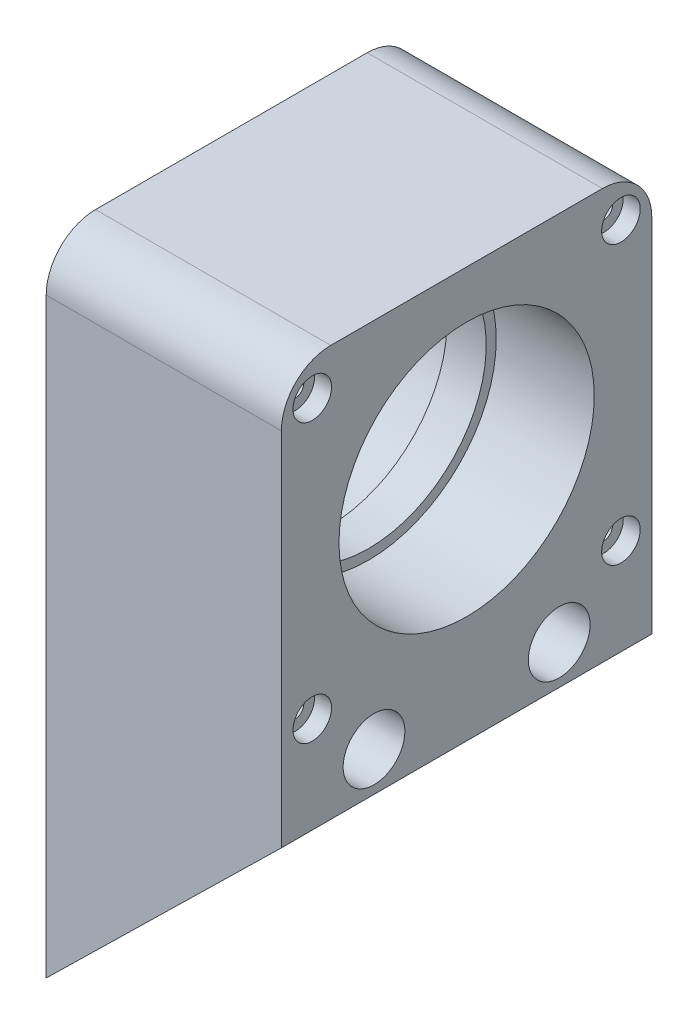
from build123d import *

# Parameters (mm, degrees)
BOSS_EXTRUDE1_DEPTH = 120
SKETCH3_R           = 4.25
CUT_EXTRUDE1_DEPTH  = 120
SKETCH5_R           = 10
CUT_EXTRUDE2_DEPTH  = 53
SKETCH6_R           = 4.25
CUT_EXTRUDE3_DEPTH  = 103
SKETCH7_W           = 76.2
SKETCH7_H           = 120
BOSS_EXTRUDE2_DEPTH = 101.6
SKETCH8_R           = 41.35
CUT_EXTRUDE4_DEPTH  = 31.75
CUT_EXTRUDE5_START  = -31.75
SKETCH9_R           = 41.35
CUT_EXTRUDE5_DEPTH  = 31.75
SKETCH10_R          = 38.1
CUT_EXTRUDE6_DEPTH  = 76.2
SKETCH13_W          = 76.2
SKETCH13_H          = 120
BOSS_EXTRUDE3_DEPTH = 6
SKETCH11_R          = 2.75
CUT_EXTRUDE7_DEPTH  = 84.4
SKETCH12_R          = 6.25
CUT_EXTRUDE8_DEPTH  = 5.5
FILLET1_R           = 16


with BuildPart() as part:
    # Sketch1 → Boss-Extrude1 (new body)
    with BuildSketch(Plane.XY):
        Polygon((381, 457.2), (457.2, 457.2), (457.2, 431.8), (381, 357.2), align=None)
    extrude(amount=BOSS_EXTRUDE1_DEPTH)

    # Sketch3 → Cut-Extrude1 (cut)
    with BuildSketch(Plane(origin=(457.2, 0, 0), x_dir=(0, 0, -1), z_dir=(1, 0, 0))):
        with Locations((-90, 394.5)):
            Circle(SKETCH3_R)
        with Locations((-30, 394.5)):
            Circle(SKETCH3_R)
    extrude(amount=-CUT_EXTRUDE1_DEPTH, mode=Mode.SUBTRACT)

    # Sketch5 → Cut-Extrude2 (cut)
    with BuildSketch(Plane(origin=(457.2, 0, 0), x_dir=(0, 0, -1), z_dir=(1, 0, 0))):
        with Locations((-90, 394.5)):
            Circle(SKETCH5_R)
        with Locations((-30, 394.5)):
            Circle(SKETCH5_R)
        with Locations((-90, 444.5)):
            Circle(SKETCH5_R)
        with Locations((-30, 444.5)):
            Circle(SKETCH5_R)
    extrude(amount=-CUT_EXTRUDE2_DEPTH, mode=Mode.SUBTRACT)

    # Sketch6 → Cut-Extrude3 (cut)
    with BuildSketch(Plane(origin=(457.2, 0, 0), x_dir=(0, 0, -1), z_dir=(1, 0, 0))):
        with Locations((-90, 444.5)):
            Circle(SKETCH6_R)
        with Locations((-30, 444.5)):
            Circle(SKETCH6_R)
    extrude(amount=-CUT_EXTRUDE3_DEPTH, mode=Mode.SUBTRACT)

    # Sketch7 → Boss-Extrude2 (add)
    with BuildSketch(Plane(origin=(0, 457.2, 0), x_dir=(1, 0, 0), z_dir=(0, 1, 0))):
        with Locations((419.1, -60)):
            Rectangle(SKETCH7_W, SKETCH7_H)
    extrude(amount=BOSS_EXTRUDE2_DEPTH)

    # Sketch8 → Cut-Extrude4 (cut)
    with BuildSketch(Plane.ZY.offset(-381)):
        with Locations((60, 508)):
            Circle(SKETCH8_R)
    extrude(amount=-CUT_EXTRUDE4_DEPTH, mode=Mode.SUBTRACT)

    # Sketch9 → Cut-Extrude5 (cut)
    with BuildSketch(Plane(origin=(457.2, 0, 0), x_dir=(0, 0, -1), z_dir=(1, 0, 0)).offset(CUT_EXTRUDE5_START)):
        with Locations((-60, 508)):
            Circle(SKETCH9_R)
    extrude(amount=CUT_EXTRUDE5_DEPTH, mode=Mode.SUBTRACT)

    # Sketch10 → Cut-Extrude6 (cut)
    with BuildSketch(Plane(origin=(457.2, 0, 0), x_dir=(0, 0, -1), z_dir=(1, 0, 0))):
        with Locations((-60, 508)):
            Circle(SKETCH10_R)
    extrude(amount=-CUT_EXTRUDE6_DEPTH, mode=Mode.SUBTRACT)

    # Sketch13 → Boss-Extrude3 (add)
    with BuildSketch(Plane(origin=(0, 558.8, 0), x_dir=(1, 0, 0), z_dir=(0, 1, 0))):
        with Locations((419.1, -60)):
            Rectangle(SKETCH13_W, SKETCH13_H)
    extrude(amount=BOSS_EXTRUDE3_DEPTH)

    # Sketch11 → Cut-Extrude7 (cut)
    with BuildSketch(Plane(origin=(457.2, 0, 0), x_dir=(0, 0, -1), z_dir=(1, 0, 0))):
        with Locations((-110, 553)):
            Circle(SKETCH11_R)
        with Locations((-10, 553)):
            Circle(SKETCH11_R)
        with Locations((-110, 463)):
            Circle(SKETCH11_R)
        with Locations((-10, 463)):
            Circle(SKETCH11_R)
    extrude(amount=-CUT_EXTRUDE7_DEPTH, mode=Mode.SUBTRACT)

    # Sketch12 → Cut-Extrude8 (cut)
    with BuildSketch(Plane(origin=(457.2, 0, 0), x_dir=(0, 0, -1), z_dir=(1, 0, 0))):
        with Locations((-110, 553)):
            Circle(SKETCH12_R)
        with Locations((-10, 553)):
            Circle(SKETCH12_R)
        with Locations((-10, 463)):
            Circle(SKETCH12_R)
        with Locations((-110, 463)):
            Circle(SKETCH12_R)
    extrude(amount=-CUT_EXTRUDE8_DEPTH, mode=Mode.SUBTRACT)

    # Fillet1
    fillet1_edges = [part.edges().sort_by_distance(p)[0] for p in [
        (419.1, 564.8, 0),
        (419.1, 564.8, 120),
    ]]
    fillet(fillet1_edges, radius=FILLET1_R)


solid = part.part
